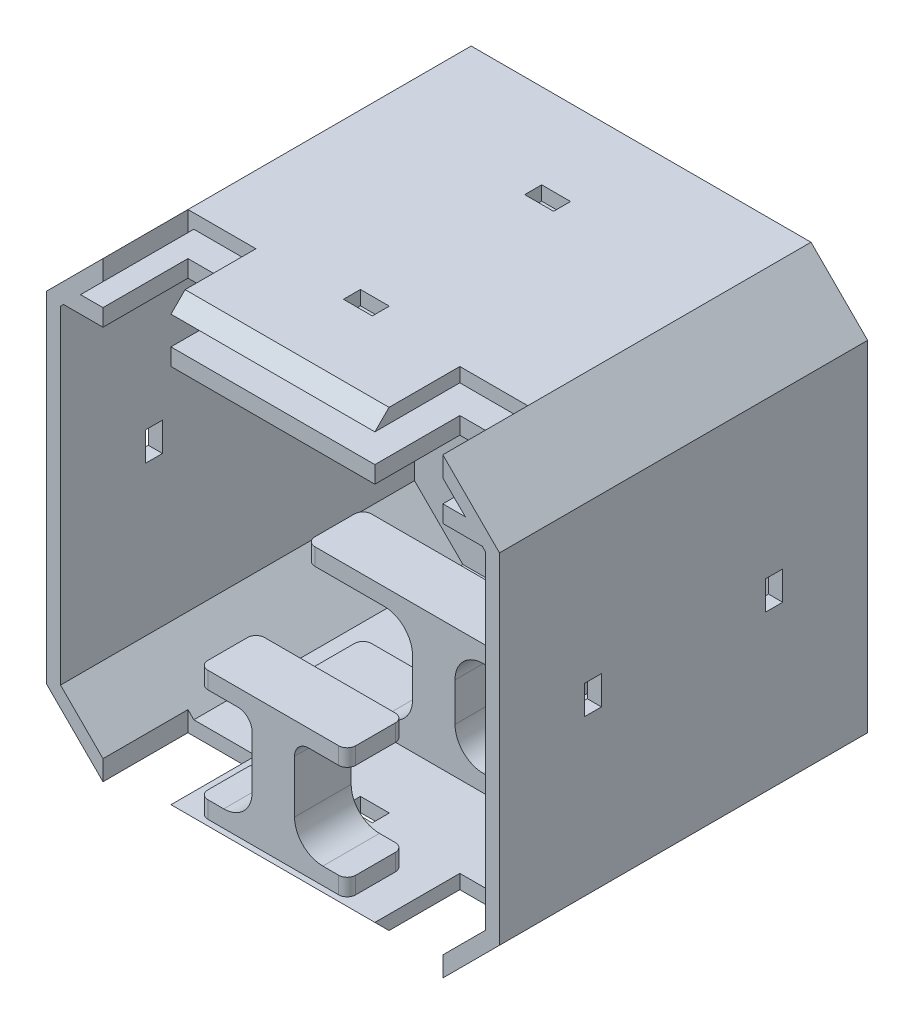
from build123d import *

# Parameters (mm, degrees)
BOSS_EXTRUDE1_DEPTH             = 65
SKETCH2_R                       = 7.5
BOSS_EXTRUDE2_DEPTH             = 2.5
BOSS_EXTRUDE3_REACH             = 88.168
SKETCH3_W                       = 65
SKETCH3_H                       = 3
BOSS_EXTRUDE3_DIRECTION_2_REACH = 88.168
CUT_EXTRUDE2_REACH              = 124.042
SKETCH6_R                       = 1.75
CUT_EXTRUDE3_REACH              = 86.299
CUT_EXTRUDE4_REACH              = 86.299
FILLET1_R                       = 2.5
FILLET2_R                       = 5
CUT_EXTRUDE5_DEPTH              = 111.566722046
CUT_EXTRUDE5_DEPTH_BACK         = 111.566722046
SKETCH9_W                       = 12
SKETCH9_H                       = 32.949220019
SKETCH9_H_2                     = 17.949220019
BOSS_EXTRUDE5_DEPTH             = 22.8
SKETCH11_W                      = 18.75
SKETCH11_H                      = 16.8
CUT_EXTRUDE6_DEPTH              = 61.48
CHAMFER1_SIZE                   = 2.5
FILLET3_R                       = 5
FILLET4_R                       = 2.5
CUT_EXTRUDE8_REACH              = 112.567
SKETCH14_W                      = 3
SKETCH14_H                      = 5.1
CIRPATTERN1_START               = -40
CIRPATTERN1_OUTLINE_W           = 5.1
CIRPATTERN1_OUTLINE_H           = 3
CIRPATTERN1_DEPTH               = 25.3
CIRPATTERN1_START_2             = -2.55
CIRPATTERN1_2_OUTLINE_W         = 2.5
CIRPATTERN1_2_OUTLINE_H         = 3
CIRPATTERN1_2_DEPTH             = 5.1
CIRPATTERN1_START_3             = 37.5
CIRPATTERN1_3_OUTLINE_W         = 5.1
CIRPATTERN1_3_OUTLINE_H         = 3
CIRPATTERN1_3_DEPTH             = 2.5
CUT_EXTRUDE9_REACH              = 89.502
SKETCH15_W                      = 18.33254108
SKETCH15_H                      = 22.8


# Read off the part's stored shape, not the designer's step: CirPattern1
with BuildPart() as part:
    # Sketch1 → Boss-Extrude1 (new body)
    with BuildSketch(Plane.XY):
        Polygon((-40, 30), (-30, 40), (30, 40), (40, 30), (40, -30), (30, -40), (-30, -40), (-40, -30), align=None)
        Polygon((-37.5, 28.964466094), (-28.964466094, 37.5), (28.964466094, 37.5), (37.5, 28.964466094), (37.5, -28.964466094), (28.964466094, -37.5), (-28.964466094, -37.5), (-37.5, -28.964466094), align=None, mode=Mode.SUBTRACT)
    extrude(amount=BOSS_EXTRUDE1_DEPTH)

    # Sketch2 → Boss-Extrude2 (add)
    with BuildSketch(Plane.XY):
        Polygon((37.5, 28.964466094), (28.964466094, 37.5), (-28.964466094, 37.5), (-37.5, 28.964466094), (-37.5, -28.964466094), (-28.964466094, -37.5), (28.964466094, -37.5), (37.5, -28.964466094), align=None)
        Circle(SKETCH2_R, mode=Mode.SUBTRACT)
    extrude(amount=BOSS_EXTRUDE2_DEPTH)

    # Boss-Extrude3: up to this plane
    boss_extrude3_end = Plane(origin=(28.964466094, 37.5, 65), z_dir=(-0.7071067811865476, -0.7071067811865476, 0))
    # Sketch3 → Boss-Extrude3 (add, up to the surface)
    with BuildSketch(Plane(origin=(0, 0, 0), x_dir=(0, 0, -1), z_dir=(1, 0, 0)), mode=Mode.PRIVATE) as boss_extrude3_sk1:
        with Locations((-32.5, 31)):
            Rectangle(SKETCH3_W, SKETCH3_H)
    boss_extrude3_tool1 = split(extrude(boss_extrude3_sk1.sketch, amount=BOSS_EXTRUDE3_REACH, mode=Mode.PRIVATE), bisect_by=boss_extrude3_end, keep=Keep.BOTH, mode=Mode.PRIVATE)
    add(boss_extrude3_tool1.solids().sort_by_distance((0, 31, 32.5))[0])

    # Boss-Extrude3 direction 2: up to this plane
    boss_extrude3_direction_2_end = Plane(origin=(-37.5, 28.964466094, 65), z_dir=(0.707106781186547, -0.7071067811865481, 0))
    # Sketch3 → Boss-Extrude3 direction 2 (add, up to the surface)
    with BuildSketch(Plane(origin=(0, 0, 0), x_dir=(0, 0, -1), z_dir=(1, 0, 0)), mode=Mode.PRIVATE) as boss_extrude3_direction_2_sk1:
        with Locations((-32.5, 31)):
            Rectangle(SKETCH3_W, SKETCH3_H)
    boss_extrude3_direction_2_tool1 = split(extrude(boss_extrude3_direction_2_sk1.sketch, amount=-BOSS_EXTRUDE3_DIRECTION_2_REACH, mode=Mode.PRIVATE), bisect_by=boss_extrude3_direction_2_end, keep=Keep.BOTH, mode=Mode.PRIVATE)
    add(boss_extrude3_direction_2_tool1.solids().sort_by_distance((0, 31, 32.5))[0])

    # Sketch6 → Cut-Extrude2 (cut, up to next)
    with BuildSketch(Plane(origin=(0, 29.5, -27), x_dir=(-1, 0, 0), z_dir=(0, -1, 0)), mode=Mode.PRIVATE) as cut_extrude2_sk1:
        with Locations(Location((-4.5, -72, 0), (0, 0, 90))):
            Circle(SKETCH6_R)
    cut_extrude2_tool1 = extrude(cut_extrude2_sk1.sketch, amount=-CUT_EXTRUDE2_REACH, mode=Mode.PRIVATE) & part.part
    # Sketch6 → Cut-Extrude2 (cut, up to next)
    with BuildSketch(Plane(origin=(0, 29.5, -27), x_dir=(-1, 0, 0), z_dir=(0, -1, 0)), mode=Mode.PRIVATE) as cut_extrude2_sk2:
        with Locations(Location((25.5, -37, 0), (0, 0, 90))):
            Circle(SKETCH6_R)
    cut_extrude2_tool2 = extrude(cut_extrude2_sk2.sketch, amount=-CUT_EXTRUDE2_REACH, mode=Mode.PRIVATE) & part.part
    add(cut_extrude2_tool1.solids().sort_by_distance((4.5, 29.5, 45))[0], mode=Mode.SUBTRACT)
    add(cut_extrude2_tool2.solids().sort_by_distance((-25.5, 29.5, 10))[0], mode=Mode.SUBTRACT)

    # Sketch7 → Cut-Extrude3 (cut, up to next)
    with BuildSketch(Plane.XY.offset(2.5), mode=Mode.PRIVATE) as cut_extrude3_sk1:
        Polygon((-33.964466094, 32.5), (-28.964466094, 37.5), (28.964466094, 37.5), (33.964466094, 32.5), align=None)
    cut_extrude3_tool1 = extrude(cut_extrude3_sk1.sketch, amount=-CUT_EXTRUDE3_REACH, mode=Mode.PRIVATE) & part.part
    add(cut_extrude3_tool1.solids().sort_by_distance((0, 34.933788, 2.5))[0], mode=Mode.SUBTRACT)

    # Sketch8 → Cut-Extrude4 (cut, up to next)
    with BuildSketch(Plane.XY.offset(2.5), mode=Mode.PRIVATE) as cut_extrude4_sk1:
        Polygon((-7.5, 0), (-7.5, 11), (-10.5, 11), (-20.5, 11), (-20.5, 20), (-0.5, 20), (-0.5, 7.5), (0, 7.5), align=None)
    cut_extrude4_tool1 = extrude(cut_extrude4_sk1.sketch, amount=-CUT_EXTRUDE4_REACH, mode=Mode.PRIVATE) & part.part
    add(cut_extrude4_tool1.solids().sort_by_distance((-9.150457, 13.572273, 2.5))[0], mode=Mode.SUBTRACT)

    # Fillet1
    fillet1_edges = [part.edges().sort_by_distance(p)[0] for p in [
        (-20.5, 11, 1.25),
        (-20.5, 20, 1.25),
        (-0.5, 20, 1.25),
    ]]
    fillet(fillet1_edges, radius=FILLET1_R)

    # Fillet2
    fillet2_edges = [part.edges().sort_by_distance(p)[0] for p in [
        (-0.5, 7.5, 1.25),
        (-7.5, 11, 1.25),
    ]]
    fillet(fillet2_edges, radius=FILLET2_R)

    # Sketch9 → Cut-Extrude5 (cut, two sides: drawn at the far end of the back side and taken through both)
    with BuildSketch(Plane(origin=(0, 40, 0), x_dir=(1, 0, 0), z_dir=(0, 1, 0)).offset(-CUT_EXTRUDE5_DEPTH_BACK)):
        with Locations((24, -66.474610009)):
            Rectangle(SKETCH9_W, SKETCH9_H)
        with Locations((-24, -58.97461001)):
            Rectangle(SKETCH9_W, SKETCH9_H_2)
    extrude(amount=CUT_EXTRUDE5_DEPTH + CUT_EXTRUDE5_DEPTH_BACK, mode=Mode.SUBTRACT)

    # Sketch10 → Boss-Extrude5 (add)
    with BuildSketch(Plane(origin=(0, -37.5, 0), x_dir=(1, 0, 0), z_dir=(0, 1, 0))):
        with BuildLine():
            Line((-4.70239318, -35.65016071), (-21.95239318, -35.65016071))
            ThreePointArc((-21.95239318, -35.65016071), (-23.013053352, -35.210820882), (-23.45239318, -34.15016071))
            Line((-23.45239318, -34.15016071), (-23.45239318, -27.14854667))
            ThreePointArc((-23.45239318, -27.14854667), (-23.013053352, -26.087886498), (-21.95239318, -25.64854667))
            Line((-21.95239318, -25.64854667), (20.04760682, -25.64854667))
            ThreePointArc((20.04760682, -25.64854667), (21.108266992, -26.087886498), (21.54760682, -27.14854667))
            Line((21.54760682, -27.14854667), (21.54760682, -34.15016071))
            ThreePointArc((21.54760682, -34.15016071), (21.108266992, -35.210820882), (20.04760682, -35.65016071))
            Line((20.04760682, -35.65016071), (2.79760682, -35.65016071))
            Line((2.79760682, -35.65016071), (2.79760682, -53.98270179))
            Line((2.79760682, -53.98270179), (10.59521364, -53.98270179))
            ThreePointArc((10.59521364, -53.98270179), (11.655873812, -54.422041618), (12.09521364, -55.48270179))
            Line((12.09521364, -55.48270179), (12.09521364, -62.48))
            ThreePointArc((12.09521364, -62.48), (11.655873812, -63.540660172), (10.59521364, -63.98))
            Line((10.59521364, -63.98), (-12.5, -63.98))
            ThreePointArc((-12.5, -63.98), (-13.560660172, -63.540660172), (-14, -62.48))
            Line((-14, -62.48), (-14, -55.48270179))
            ThreePointArc((-14, -55.48270179), (-13.560660172, -54.422041618), (-12.5, -53.98270179))
            Line((-12.5, -53.98270179), (-4.70239318, -53.98270179))
            Line((-4.70239318, -53.98270179), (-4.70239318, -35.65016071))
        make_face()
    extrude(amount=BOSS_EXTRUDE5_DEPTH)

    # Sketch11 → Cut-Extrude6 (cut)
    with BuildSketch(Plane.XY.offset(63.98)):
        with Locations((-14.07739318, -26.1)):
            Rectangle(SKETCH11_W, SKETCH11_H)
        with Locations((12.17260682, -26.1)):
            Rectangle(SKETCH11_W, SKETCH11_H)
    extrude(amount=-CUT_EXTRUDE6_DEPTH, mode=Mode.SUBTRACT)

    # Chamfer1
    chamfer1_edges = [part.edges().sort_by_distance(p)[0] for p in [
        (0, 40, 65),
        (0, -40, 65),
    ]]
    chamfer(chamfer1_edges, length=CHAMFER1_SIZE - 0.0001)  # a hair under: the kernel refuses the full size

    # Fillet3
    fillet3_edges = [part.edges().sort_by_distance(p)[0] for p in [
        (-4.70239318, -17.7, 30.64935369),
        (-4.70239318, -34.5, 30.64935369),
        (-4.70239318, -34.5, 58.981350895),
        (2.79760682, -34.5, 58.981350895),
        (2.79760682, -34.5, 30.64935369),
        (2.79760682, -17.7, 30.64935369),
    ]]
    fillet(fillet3_edges, radius=FILLET3_R)

    # Fillet4
    fillet4_edges = [part.edges().sort_by_distance(p)[0] for p in [
        (-4.70239318, -17.7, 58.981350895),
        (2.79760682, -17.7, 58.981350895),
    ]]
    fillet(fillet4_edges, radius=FILLET4_R)

    # Sketch14 → Cut-Extrude8 (cut, up to next)
    with BuildSketch(Plane(origin=(40, 0, 0), x_dir=(0, 0, -1), z_dir=(1, 0, 0)), mode=Mode.PRIVATE) as cut_extrude8_sk1:
        with Locations((-48.5, 0)):
            Rectangle(SKETCH14_W, SKETCH14_H)
    cut_extrude8_tool1 = extrude(cut_extrude8_sk1.sketch, amount=-CUT_EXTRUDE8_REACH, mode=Mode.PRIVATE) & part.part
    # Sketch14 → Cut-Extrude8 (cut, up to next)
    with BuildSketch(Plane(origin=(40, 0, 0), x_dir=(0, 0, -1), z_dir=(1, 0, 0)), mode=Mode.PRIVATE) as cut_extrude8_sk2:
        with Locations((-16.5, 0)):
            Rectangle(SKETCH14_W, SKETCH14_H)
    cut_extrude8_tool2 = extrude(cut_extrude8_sk2.sketch, amount=-CUT_EXTRUDE8_REACH, mode=Mode.PRIVATE) & part.part
    add(cut_extrude8_tool1.solids().sort_by_distance((40, 0, 48.5))[0], mode=Mode.SUBTRACT)
    add(cut_extrude8_tool2.solids().sort_by_distance((40, 0, 16.5))[0], mode=Mode.SUBTRACT)

    # CirPattern1 outline → CirPattern1 (cut)
    with BuildSketch(Plane(origin=(0, 0, 0), x_dir=(1, 0, 0), z_dir=(0, 1, 0)).offset(CIRPATTERN1_START)):
        with Locations((0, -16.5)):
            Rectangle(CIRPATTERN1_OUTLINE_W, CIRPATTERN1_OUTLINE_H)
        with Locations((0, -48.5)):
            Rectangle(CIRPATTERN1_OUTLINE_W, CIRPATTERN1_OUTLINE_H)
    extrude(amount=CIRPATTERN1_DEPTH, mode=Mode.SUBTRACT)

    # CirPattern1 2 outline → CirPattern1 2 (cut)
    with BuildSketch(Plane(origin=(0, 0, 0), x_dir=(1, 0, 0), z_dir=(0, 1, 0)).offset(CIRPATTERN1_START_2)):
        with Locations((-38.75, -16.5)):
            Rectangle(CIRPATTERN1_2_OUTLINE_W, CIRPATTERN1_2_OUTLINE_H)
        with Locations((-38.75, -48.5)):
            Rectangle(CIRPATTERN1_2_OUTLINE_W, CIRPATTERN1_2_OUTLINE_H)
    extrude(amount=CIRPATTERN1_2_DEPTH, mode=Mode.SUBTRACT)

    # CirPattern1 3 outline → CirPattern1 3 (cut)
    with BuildSketch(Plane(origin=(0, 0, 0), x_dir=(1, 0, 0), z_dir=(0, 1, 0)).offset(CIRPATTERN1_START_3)):
        with Locations((0, -16.5)):
            Rectangle(CIRPATTERN1_3_OUTLINE_W, CIRPATTERN1_3_OUTLINE_H)
        with Locations((0, -48.5)):
            Rectangle(CIRPATTERN1_3_OUTLINE_W, CIRPATTERN1_3_OUTLINE_H)
    extrude(amount=CIRPATTERN1_3_DEPTH, mode=Mode.SUBTRACT)

    # Sketch15 → Cut-Extrude9 (cut, up to next)
    with BuildSketch(Plane(origin=(2.79760682, 0, 0), x_dir=(0, 0, -1), z_dir=(1, 0, 0)), mode=Mode.PRIVATE) as cut_extrude9_sk1:
        with Locations((-44.81643125, -26.1)):
            Rectangle(SKETCH15_W, SKETCH15_H)
    cut_extrude9_tool1 = extrude(cut_extrude9_sk1.sketch, amount=-CUT_EXTRUDE9_REACH, mode=Mode.PRIVATE) & part.part
    add(cut_extrude9_tool1.solids().sort_by_distance((2.797607, -26.1, 44.816431))[0], mode=Mode.SUBTRACT)


solid = part.part
